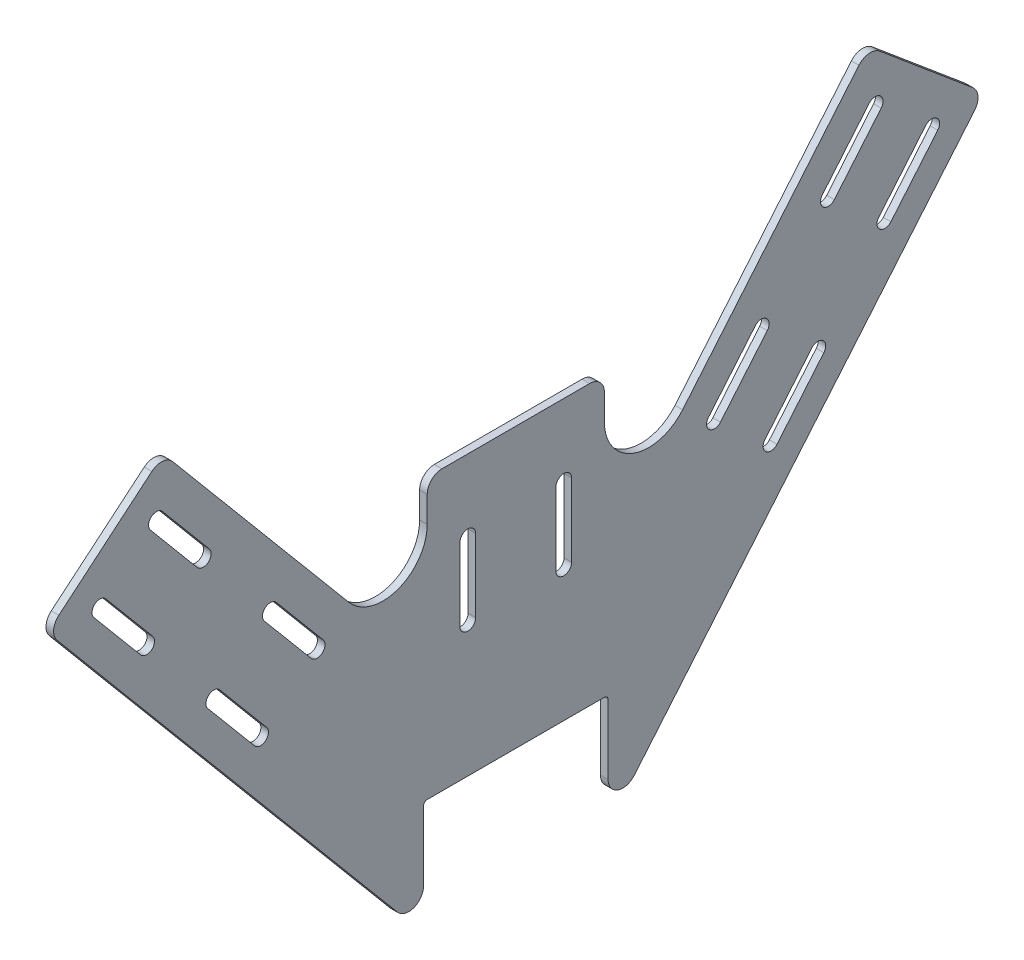
from build123d import *

# Parameters (mm, degrees)
BASE_FLANGE1_DEPTH          = 3.2639
F_1_4_START                 = -3.2639
F_1_4_CLEARANCE_SLOT1_DEPTH = 3.2639
SKETCH9_W                   = 1.5875
SKETCH9_H                   = 50.8
CUT_EXTRUDE1_DEPTH          = 274.80079868
FILLET1_R                   = 6.35
FILLET2_R                   = 19.05
FILLET3_R                   = 6.35
FILLET4_R                   = 1.5875
F_1_4_CLEARANCE_SLOT2_DEPTH = 3.2639
F_1_4_CLEARANCE_SLOT3_DEPTH = 3.2639


# Read off the part's stored shape, not the designer's step: 1/4 Clearance Slot1, 1/4 Clearance Slot2, 1/4 Clearance Slot3
# Sheet-metal steps are written as plain solids
with BuildPart() as part:
    # Sketch1 → Base-Flange1 (new body)
    with BuildSketch(Plane(origin=(0, 0, 0), x_dir=(0, 0, -1), z_dir=(1, 0, 0))):
        Polygon((38.1, 0), (38.1, -50.8), (201.36805286, 143.775288552), (151.652495469, 185.491594423), (38.1, 50.165), (38.1, 120.015), (-38.1, 120.015), (-38.1, 50.165), (-151.652495469, 185.491594423), (-201.36805286, 143.775288552), (-38.1, -50.8), (-38.1, 0), align=None)
    extrude(amount=-BASE_FLANGE1_DEPTH)

    # 1/4 Clearance Slot1 outline → 1/4 Clearance Slot1 (cut)
    with BuildSketch(Plane.YZ.offset(F_1_4_START)):
        with BuildLine():
            Line((57.3532, -24.0157), (88.6968, -24.0157))
            ThreePointArc((88.6968, -24.0157), (92.075, -20.6375), (88.6968, -17.2593))
            Line((88.6968, -17.2593), (57.3532, -17.2593))
            ThreePointArc((57.3532, -17.2593), (53.975, -20.6375), (57.3532, -24.0157))
        make_face()
        with BuildLine():
            Line((57.3532, 17.2593), (88.6968, 17.2593))
            ThreePointArc((88.6968, 17.2593), (92.075, 20.6375), (88.6968, 24.0157))
            Line((88.6968, 24.0157), (57.3532, 24.0157))
            ThreePointArc((57.3532, 24.0157), (53.975, 20.6375), (57.3532, 17.2593))
        make_face()
    extrude(amount=F_1_4_CLEARANCE_SLOT1_DEPTH, mode=Mode.SUBTRACT)

    # Sketch9 → Cut-Extrude1 (cut, through all)
    with BuildSketch(Plane(origin=(0, 0, 0), x_dir=(0, 0, -1), z_dir=(1, 0, 0))):
        with Locations((-38.89375, -25.4)):
            Rectangle(SKETCH9_W, SKETCH9_H)
        with Locations((38.89375, -25.4)):
            Rectangle(SKETCH9_W, SKETCH9_H)
    extrude(amount=-CUT_EXTRUDE1_DEPTH, mode=Mode.SUBTRACT)

    # Fillet1
    fillet1_edges = [part.edges().sort_by_distance(p)[0] for p in [
        (-1.63195, 185.491594423, -151.652495469),
        (-1.63195, 143.775288552, -201.36805286),
        (-1.63195, 143.775288552, 201.36805286),
        (-1.63195, 185.491594423, 151.652495469),
        (-1.63195, -48.908091172, 39.6875),
        (-1.63195, -48.908091172, -39.6875),
    ]]
    fillet(fillet1_edges, radius=FILLET1_R)

    # Fillet2
    fillet2_edges = [part.edges().sort_by_distance(p)[0] for p in [
        (-1.63195, 50.165, -38.1),
        (-1.63195, 50.165, 38.1),
    ]]
    fillet(fillet2_edges, radius=FILLET2_R)

    # Fillet3
    fillet3_edges = [part.edges().sort_by_distance(p)[0] for p in [
        (-1.63195, 120.015, 38.1),
        (-1.63195, 120.015, -38.1),
    ]]
    fillet(fillet3_edges, radius=FILLET3_R)

    # Fillet4
    fillet4_edges = [part.edges().sort_by_distance(p)[0] for p in [
        (-1.63195, 0, 39.6875),
        (-1.63195, 0, -39.6875),
    ]]
    fillet(fillet4_edges, radius=FILLET4_R)

    # 1/4 Clearance Slot2 outline → 1/4 Clearance Slot2 (cut)
    with BuildSketch(Plane.YZ.offset(F_1_4_START)):
        with BuildLine():
            Line((105.870311236, -102.982051315), (81.859720628, -82.834773592))
            ThreePointArc((81.859720628, -82.834773592), (77.100404187, -83.251159826), (77.516790422, -88.010476267))
            Line((77.516790422, -88.010476267), (101.527381029, -108.15775399))
            ThreePointArc((101.527381029, -108.15775399), (106.28669747, -107.741367756), (105.870311236, -102.982051315))
        make_face()
        with BuildLine():
            ThreePointArc((140.232307194, -131.81518945), (135.472990753, -132.231575685), (135.889376988, -136.990892126))
            Line((135.889376988, -136.990892126), (159.899967595, -157.138169849))
            ThreePointArc((159.899967595, -157.138169849), (164.659284036, -156.721783614), (164.242897801, -151.962467173))
            Line((164.242897801, -151.962467173), (140.232307194, -131.81518945))
        make_face()
        with BuildLine():
            Line((85.461804628, -127.303962384), (61.451214021, -107.156684661))
            ThreePointArc((61.451214021, -107.156684661), (56.69189758, -107.573070895), (57.108283815, -112.332387336))
            Line((57.108283815, -112.332387336), (81.118874422, -132.479665059))
            ThreePointArc((81.118874422, -132.479665059), (85.878190863, -132.063278825), (85.461804628, -127.303962384))
        make_face()
        with BuildLine():
            ThreePointArc((119.823800586, -156.137100519), (115.064484146, -156.553486754), (115.48087038, -161.312803195))
            Line((115.48087038, -161.312803195), (139.491460988, -181.460080918))
            ThreePointArc((139.491460988, -181.460080918), (144.250777428, -181.043694683), (143.834391194, -176.284378242))
            Line((143.834391194, -176.284378242), (119.823800586, -156.137100519))
        make_face()
    extrude(amount=F_1_4_CLEARANCE_SLOT2_DEPTH, mode=Mode.SUBTRACT)

    # 1/4 Clearance Slot3 outline → 1/4 Clearance Slot3 (cut)
    with BuildSketch(Plane.YZ.offset(F_1_4_START)):
        with BuildLine():
            Line((61.451214021, 107.156684661), (85.461804628, 127.303962384))
            ThreePointArc((85.461804628, 127.303962384), (85.878190863, 132.063278825), (81.118874422, 132.479665059))
            Line((81.118874422, 132.479665059), (57.108283815, 112.332387336))
            ThreePointArc((57.108283815, 112.332387336), (56.69189758, 107.573070895), (61.451214021, 107.156684661))
        make_face()
        with BuildLine():
            ThreePointArc((143.834391194, 176.284378242), (144.250777428, 181.043694683), (139.491460988, 181.460080918))
            Line((139.491460988, 181.460080918), (115.48087038, 161.312803195))
            ThreePointArc((115.48087038, 161.312803195), (115.064484146, 156.553486754), (119.823800586, 156.137100519))
            Line((119.823800586, 156.137100519), (143.834391194, 176.284378242))
        make_face()
        with BuildLine():
            Line((81.859720628, 82.834773592), (105.870311236, 102.982051315))
            ThreePointArc((105.870311236, 102.982051315), (106.28669747, 107.741367756), (101.527381029, 108.15775399))
            Line((101.527381029, 108.15775399), (77.516790422, 88.010476267))
            ThreePointArc((77.516790422, 88.010476267), (77.100404187, 83.251159826), (81.859720628, 82.834773592))
        make_face()
        with BuildLine():
            ThreePointArc((164.242897801, 151.962467173), (164.659284036, 156.721783614), (159.899967595, 157.138169849))
            Line((159.899967595, 157.138169849), (135.889376988, 136.990892126))
            ThreePointArc((135.889376988, 136.990892126), (135.472990753, 132.231575685), (140.232307194, 131.81518945))
            Line((140.232307194, 131.81518945), (164.242897801, 151.962467173))
        make_face()
    extrude(amount=F_1_4_CLEARANCE_SLOT3_DEPTH, mode=Mode.SUBTRACT)


solid = part.part
